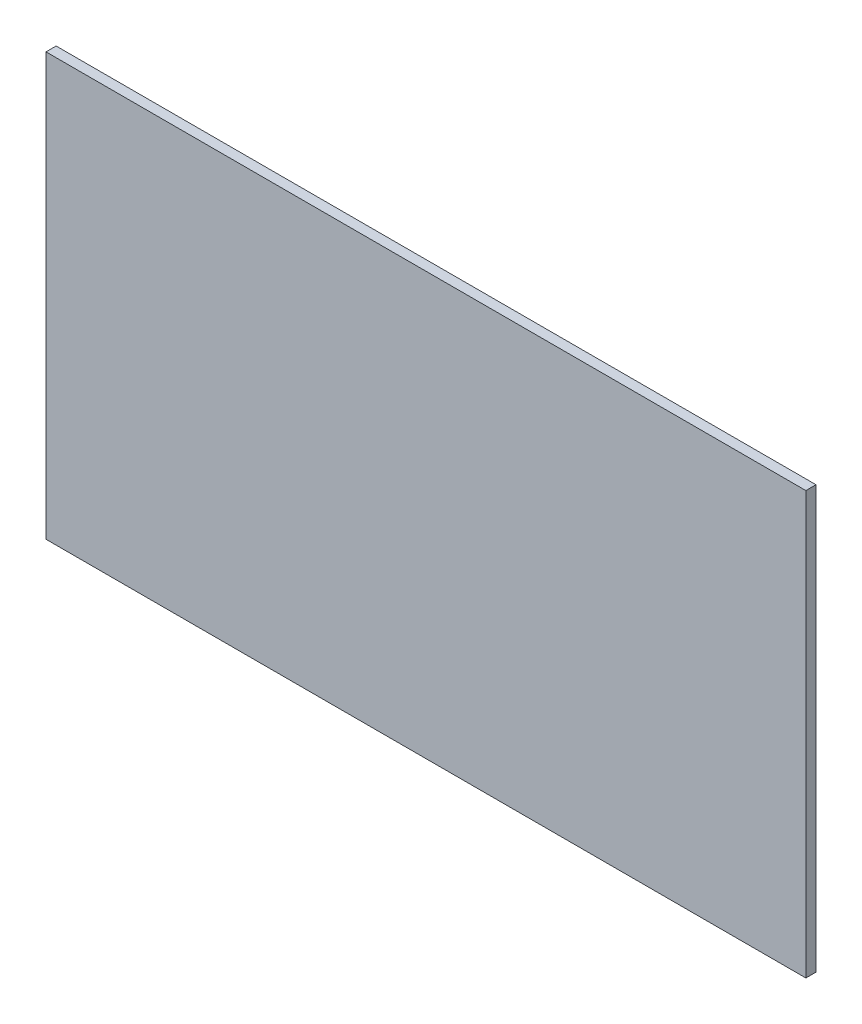
from build123d import *

# Parameters (mm, degrees)
SKETCH_1_W             = 90
SKETCH_1_H             = 50
SM_BASE_FLANGE_1_DEPTH = 1.2


# Sheet-metal steps are written as plain solids
with BuildPart() as part:
    # Sketch 1 → 基体-法兰1 (new body)
    with BuildSketch(Plane.XY):
        Rectangle(SKETCH_1_W, SKETCH_1_H)
    extrude(amount=-SM_BASE_FLANGE_1_DEPTH)


solid = part.part
